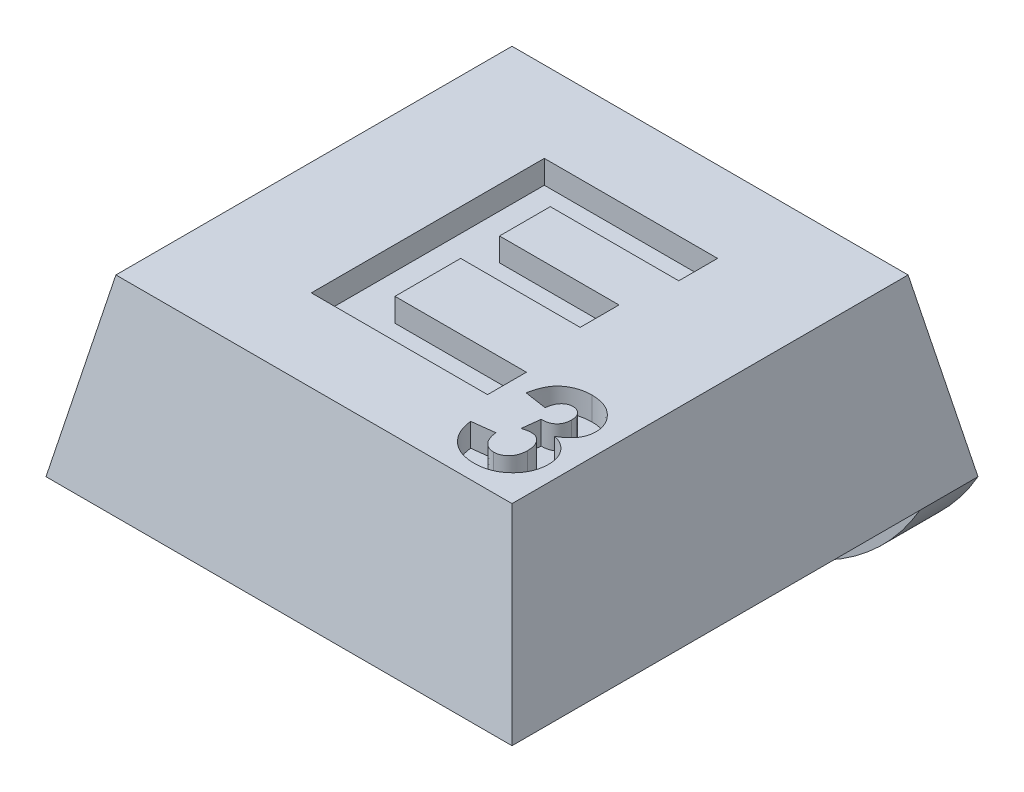
from build123d import *

# Parameters (mm, degrees)
SKETCH1_W               = 8
SKETCH1_H               = 8
BOSS_EXTRUDE1_DEPTH     = 3
CUT_EXTRUDE1_DEPTH      = 12.704699911
CUT_EXTRUDE1_DEPTH_BACK = 12.704699911
CUT_EXTRUDE2_DEPTH      = 11
SKETCH4_R               = 1.8
CUT_EXTRUDE3_DEPTH      = 0.8
SKETCH5_W               = 8
SKETCH5_H               = 1
BOSS_EXTRUDE2_DEPTH     = 2
FILLET1_R               = 4
CUT_EXTRUDE4_DEPTH      = 0.4
CUT_EXTRUDE5_DEPTH      = 0.4


with BuildPart() as part:
    # Sketch1 → Boss-Extrude1 (new body)
    with BuildSketch(Plane(origin=(0, 0, 0), x_dir=(1, 0, 0), z_dir=(0, 1, 0))):
        with Locations((4, 4)):
            Rectangle(SKETCH1_W, SKETCH1_H)
    extrude(amount=BOSS_EXTRUDE1_DEPTH)

    # Sketch2 → Cut-Extrude1 (cut, two sides: drawn at the far end of the back side and taken through both)
    with BuildSketch(Plane.XY.offset(-CUT_EXTRUDE1_DEPTH_BACK)):
        Polygon((0, 0), (0.6, 3), (0, 3), align=None)
        Polygon((8, 0), (7.4, 3), (8, 3), align=None)
    extrude(amount=CUT_EXTRUDE1_DEPTH + CUT_EXTRUDE1_DEPTH_BACK, mode=Mode.SUBTRACT)

    # Sketch3 → Cut-Extrude2 (cut)
    with BuildSketch(Plane(origin=(0, 0, 0), x_dir=(0, 0, -1), z_dir=(1, 0, 0))):
        Polygon((0, 0), (0.6, 3), (0, 3), align=None)
        Polygon((8, 3), (7.4, 3), (8, 0), align=None)
    extrude(amount=CUT_EXTRUDE2_DEPTH, mode=Mode.SUBTRACT)

    # Sketch4 → Cut-Extrude3 (cut)
    with BuildSketch(Plane.XZ):
        with Locations(Location((4, -3.75, 0), (0, 0, 270))):
            Circle(SKETCH4_R)
    extrude(amount=-CUT_EXTRUDE3_DEPTH, mode=Mode.SUBTRACT)

    # Sketch5 → Boss-Extrude2 (add)
    with BuildSketch(Plane.XZ):
        with Locations((4, -7.5)):
            Rectangle(SKETCH5_W, SKETCH5_H)
    extrude(amount=BOSS_EXTRUDE2_DEPTH)

    # Fillet1
    # the kernel refuses this fillet: 4 mm, written as the material it takes off along each edge
    with BuildSketch(Plane(origin=(8, -2, -16.660254038), x_dir=(0, 1, 0), z_dir=(0, 0, 1)), Plane(origin=(0, -2, 1.660254038), x_dir=(0, 1, 0), z_dir=(0, 0, -1))) as fillet1_piece_1:
        with BuildLine():
            CenterArc((4, 3.464101615), FILLET1_R, 180, 60)
            Line((0, 3.464101615), (-0.08, 3.464101615))
            Line((-0.08, 3.464101615), (-0.08, 0))
            Line((-0.08, 0), (0, -0.08))
            ThreePointArc((0, -0.08), (1, -0.08), (1.96, -0.069282032))
            Line((1.96, -0.069282032), (2, 0))
        make_face()
    extrude(amount=18.320508076, mode=Mode.SUBTRACT)

    # Sketch6 → Cut-Extrude4 (cut)
    with BuildSketch(Plane(origin=(0, 3, 0), x_dir=(1, 0, 0), z_dir=(0, 1, 0))):
        Polygon((2.544225106, 2.010567225), (2.544225106, 6.010567225), (5.51858408, 6.010567225), (5.51858408, 5.343900558), (3.313455875, 5.343900558), (3.313455875, 4.472105686), (5.364737926, 4.472105686), (5.364737926, 3.80543902), (3.313455875, 3.80543902), (3.313455875, 2.677233891), (5.569866131, 2.677233891), (5.569866131, 2.010567225), align=None)
    extrude(amount=-CUT_EXTRUDE4_DEPTH, mode=Mode.SUBTRACT)

    # Sketch7 → Cut-Extrude5 (cut)
    with BuildSketch(Plane(origin=(0, 3, 0), x_dir=(1, 0, 0), z_dir=(0, 1, 0))):
        with BuildLine():
            Line((5.822088817, 1.468310464), (6.206704202, 1.515586105))
            add(Edge.make_bspline(
                [(6.206704202, 1.515586105), (6.210025755, 1.491936921), (6.21633053, 1.447047438), (6.235989072, 1.384914698), (6.261652315, 1.330845836), (6.295629161, 1.286544364), (6.334912115, 1.251310519), (6.37872169, 1.226169889), (6.426661607, 1.210315729), (6.460052531, 1.208713548), (6.477136894, 1.207893797)],
                knots=[0, 0, 0, 0, 1.26631894, 2.403651751, 3.447242243, 4.428907923, 5.348362865, 6.231623936, 7.095215805, 8, 8, 8, 8], degree=3))
            add(Edge.make_bspline(
                [(6.477136894, 1.207893797), (6.486366298, 1.208091994), (6.504648304, 1.20848459), (6.531523321, 1.212603697), (6.557345996, 1.219374529), (6.58186155, 1.229117251), (6.605187017, 1.241222715), (6.627629553, 1.255638676), (6.648246393, 1.273643613), (6.668375088, 1.29334292), (6.68623752, 1.315767324), (6.701972196, 1.340096861), (6.715784117, 1.366090219), (6.726489771, 1.394417604), (6.734869896, 1.424465406), (6.740860884, 1.456364057), (6.744506994, 1.489993317), (6.74494315, 1.513039367), (6.74516574, 1.524800849)],
                knots=[0, 0, 0, 0, 0.951760839, 1.885289532, 2.797832748, 3.70117291, 4.60103766, 5.506897018, 6.445598779, 7.420035506, 8.410036365, 9.396193293, 10.407074535, 11.440988179, 12.514285005, 13.622404236, 14.786601276, 16, 16, 16, 16], degree=3))
            add(Edge.make_bspline(
                [(6.74516574, 1.524800849), (6.744331981, 1.546629456), (6.742741494, 1.588269906), (6.730451294, 1.647346431), (6.709137892, 1.699277092), (6.679276772, 1.743130281), (6.643793264, 1.778406879), (6.604044422, 1.8049236), (6.559654571, 1.820157256), (6.528795478, 1.822230353), (6.513194586, 1.823278413)],
                knots=[0, 0, 0, 0, 1.241512862, 2.368321189, 3.414110003, 4.41529485, 5.36642979, 6.245396713, 7.112955941, 8, 8, 8, 8], degree=3))
            add(Edge.make_bspline(
                [(6.513194586, 1.823278413), (6.502087722, 1.822994208), (6.47854234, 1.822391724), (6.441918774, 1.81613185), (6.401980616, 1.80749294), (6.374785766, 1.799182881), (6.360550356, 1.7948329)],
                knots=[0, 0, 0, 0, 0.854525515, 1.811503923, 2.854410343, 4, 4, 4, 4], degree=3))
            Line((6.360550356, 1.7948329), (6.396608048, 2.105329695))
            add(Edge.make_bspline(
                [(6.396608048, 2.105329695), (6.407296254, 2.105146348), (6.428036665, 2.104790564), (6.458323888, 2.107301653), (6.486673662, 2.111886341), (6.513019839, 2.119324972), (6.53738695, 2.128349551), (6.559988104, 2.139688262), (6.580270378, 2.153798702), (6.604965361, 2.175098338), (6.630230561, 2.207014566), (6.6530719, 2.250778884), (6.665798637, 2.300679459), (6.667408863, 2.335629458), (6.668242663, 2.353727131)],
                knots=[0, 0, 0, 0, 0.916749589, 1.778948191, 2.604102396, 3.376994206, 4.124053722, 4.831292757, 5.54010828, 6.238660037, 7.62386988, 9.002523041, 10.447858069, 12, 12, 12, 12], degree=3))
            add(Edge.make_bspline(
                [(6.668242663, 2.353727131), (6.667680515, 2.36913782), (6.666602635, 2.398686702), (6.656933325, 2.440733393), (6.640429824, 2.477855418), (6.617345194, 2.50940841), (6.589028098, 2.535030406), (6.555929861, 2.553963194), (6.518019093, 2.565003531), (6.491366313, 2.566231188), (6.477537535, 2.566868156)],
                knots=[0, 0, 0, 0, 1.146968804, 2.199229744, 3.192297141, 4.153502289, 5.090509175, 6.0173182, 6.971286811, 8, 8, 8, 8], degree=3))
            add(Edge.make_bspline(
                [(6.477537535, 2.566868156), (6.463673911, 2.566182836), (6.436422829, 2.564835732), (6.397428508, 2.551510744), (6.361454157, 2.530893795), (6.329709376, 2.501368407), (6.302195486, 2.464646404), (6.280874208, 2.419861118), (6.265858745, 2.367714197), (6.260698213, 2.33018187), (6.257986253, 2.3104579)],
                knots=[0, 0, 0, 0, 0.889956214, 1.749345552, 2.62404616, 3.543272128, 4.520224035, 5.562553653, 6.719074424, 8, 8, 8, 8], degree=3))
            Line((6.257986253, 2.3104579), (5.873370869, 2.368150208))
            add(Edge.make_bspline(
                [(5.873370869, 2.368150208), (5.879712758, 2.397514751), (5.891852554, 2.453725064), (5.916656, 2.532479948), (5.945759151, 2.602002338), (5.979761878, 2.663071325), (6.020038823, 2.716762155), (6.067859884, 2.763365742), (6.122509575, 2.804234412), (6.183883545, 2.838478774), (6.250614825, 2.865925856), (6.321633047, 2.886240153), (6.396757082, 2.897882068), (6.448117417, 2.899417689), (6.474332407, 2.90020149)],
                knots=[0, 0, 0, 0, 1.220808349, 2.336900656, 3.3513467, 4.279992853, 5.171472476, 6.069835959, 6.985198729, 7.938095762, 8.919113729, 9.91246339, 10.934493858, 12, 12, 12, 12], degree=3))
            add(Edge.make_bspline(
                [(6.474332407, 2.90020149), (6.496795991, 2.899690329), (6.540685792, 2.898691614), (6.604687523, 2.890097866), (6.665244055, 2.876137228), (6.722439804, 2.856388937), (6.776539911, 2.831244798), (6.826641223, 2.799609265), (6.873794781, 2.763093379), (6.901724377, 2.73467508), (6.915838817, 2.720313669)],
                knots=[0, 0, 0, 0, 1.096978699, 2.143298912, 3.148181587, 4.128190255, 5.094201205, 6.055441919, 7.017302331, 8, 8, 8, 8], degree=3))
            add(Edge.make_bspline(
                [(6.915838817, 2.720313669), (6.926741328, 2.708075606), (6.948274918, 2.683904162), (6.976233385, 2.645150995), (6.999633117, 2.604882958), (7.019482141, 2.563940258), (7.034243104, 2.52137348), (7.04524752, 2.477850813), (7.051783755, 2.43298662), (7.05249893, 2.402626167), (7.052858048, 2.387380977)],
                knots=[0, 0, 0, 0, 1.065582675, 2.104636323, 3.101288825, 4.092056841, 5.059084899, 6.026073946, 7.008813224, 8, 8, 8, 8], degree=3))
            add(Edge.make_bspline(
                [(7.052858048, 2.387380977), (7.052074688, 2.365937591), (7.050530541, 2.323668734), (7.036361111, 2.262180096), (7.013586987, 2.204054017), (6.982096895, 2.149068456), (6.941041129, 2.097733658), (6.890499978, 2.050511525), (6.831958555, 2.005600039), (6.787958464, 1.980231405), (6.765197792, 1.967108541)],
                knots=[0, 0, 0, 0, 0.957571776, 1.887550067, 2.804499428, 3.740591036, 4.709432777, 5.731457079, 6.826512349, 8, 8, 8, 8], degree=3))
            add(Edge.make_bspline(
                [(6.765197792, 1.967108541), (6.778741549, 1.963844189), (6.805468134, 1.957402478), (6.844077906, 1.94426987), (6.880236126, 1.927424278), (6.914828375, 1.908914943), (6.946996208, 1.886966635), (6.977363151, 1.862646466), (7.00476785, 1.834549826), (7.03102769, 1.804865641), (7.053982146, 1.772288453), (7.074722978, 1.738388398), (7.091382436, 1.702338355), (7.105631297, 1.665065232), (7.116248441, 1.625966572), (7.124562393, 1.585334894), (7.128729622, 1.542917296), (7.129427921, 1.514124194), (7.129781125, 1.499560464)],
                knots=[0, 0, 0, 0, 1.037381978, 2.047118658, 3.030848314, 4.005687143, 4.965748246, 5.927353932, 6.897971669, 7.885165084, 8.876109723, 9.862099733, 10.840989857, 11.829385213, 12.830906716, 13.855042526, 14.915067134, 16, 16, 16, 16], degree=3))
            add(Edge.make_bspline(
                [(7.129781125, 1.499560464), (7.129332308, 1.478289376), (7.12844718, 1.43633993), (7.11872513, 1.374773186), (7.10395436, 1.3156035), (7.083598929, 1.25859183), (7.056376257, 1.204435717), (7.023823759, 1.152375398), (6.985054773, 1.102929453), (6.940845684, 1.056472589), (6.892539484, 1.013951446), (6.84063463, 0.97660242), (6.785900139, 0.944991177), (6.728022396, 0.9191431), (6.667504686, 0.899031537), (6.603826037, 0.885208987), (6.537502989, 0.875987213), (6.49212598, 0.875040406), (6.469124074, 0.874560464)],
                knots=[0, 0, 0, 0, 1.006520189, 1.984993146, 2.943645202, 3.891894145, 4.845023195, 5.808336607, 6.795092628, 7.815033679, 8.841288157, 9.838185905, 10.83832808, 11.829129029, 12.835072876, 13.85234392, 14.911338897, 16, 16, 16, 16], degree=3))
            add(Edge.make_bspline(
                [(6.469124074, 0.874560464), (6.447326457, 0.874925903), (6.404510806, 0.875643711), (6.341832261, 0.884147308), (6.281800208, 0.896657101), (6.224765045, 0.914957582), (6.170229951, 0.937498647), (6.119224255, 0.966556317), (6.070434994, 0.999582769), (6.02545616, 1.03827062), (5.983635573, 1.080436419), (5.946901196, 1.126807021), (5.914165969, 1.175902437), (5.886010541, 1.228157933), (5.862670856, 1.283709297), (5.844497682, 1.342413141), (5.830004226, 1.404089696), (5.824763645, 1.446608551), (5.822088817, 1.468310464)],
                knots=[0, 0, 0, 0, 1.077528213, 2.11651914, 3.123276654, 4.10732375, 5.075386463, 6.036572488, 7.005896639, 7.98540975, 8.966414275, 9.939311093, 10.906719916, 11.882103104, 12.870994428, 13.882228509, 14.919075059, 16, 16, 16, 16], degree=3))
        make_face()
    extrude(amount=-CUT_EXTRUDE5_DEPTH, mode=Mode.SUBTRACT)


solid = part.part
